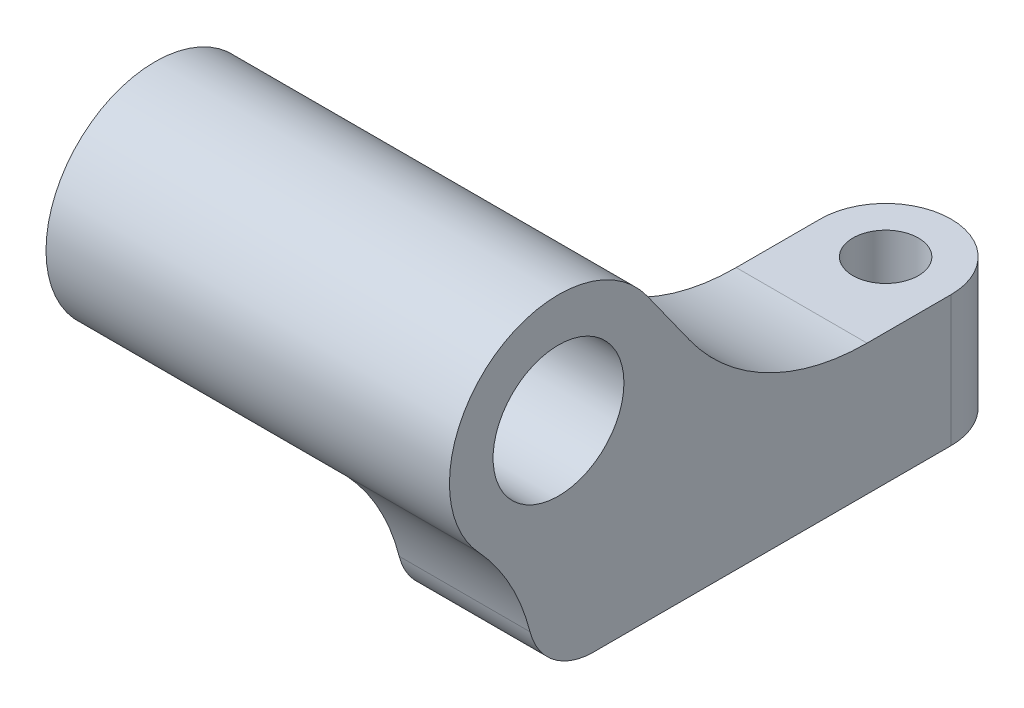
from build123d import *

# Parameters (mm, degrees)
BOSS_EXTRU_1_DEPTH      = 6
CONG_3_R                = 10
BOSS_EXTRU_2_START      = 12.5
ESQUISSE2_R             = 5
BOSS_EXTRU_2_DEPTH      = 12.5
ESQUISSE3_R             = 3
ENL_V_MAT_EXTRU_1_DEPTH = 27.424420523
BOSS_EXTRU_3_DEPTH      = 6
CONG_5_R                = 10
ESQUISSE5_R             = 1.5
ENL_V_MAT_EXTRU_2_DEPTH = 27.043233286
CONG_7_R                = 3


with BuildPart() as part:
    # Esquisse1 → Boss.-Extru.1 (new body)
    with BuildSketch(Plane(origin=(0, 0, 0), x_dir=(0, 0, -1), z_dir=(1, 0, 0))):
        with BuildLine():
            Line((-1, -4.898979486), (-1, -10))
            Line((-1, -10), (16, -10))
            Line((16, -10), (14, -4))
            Line((14, -4), (9, -4))
            Line((9, -4), (4.06913018, 2.905542906))
            ThreePointArc((4.06913018, 2.905542906), (-4.193153044, 2.723502808), (-1, -4.898979486))
        make_face()
    extrude(amount=BOSS_EXTRU_1_DEPTH)

    # Congé3
    # the kernel refuses this fillet: 10 mm, written as the material it adds along each edge
    with BuildSketch(Plane(origin=(0, -4.898979486, 1), x_dir=(0, -1, 0), z_dir=(1, 0, 0))) as cong_3_piece_1:
        with BuildLine():
            CenterArc((5.301220936, -9.997995789), CONG_3_R, 91.147140557, 41.697546603)
            Line((-1.498912679, -2.665998596), (-1.634915351, -2.519358652))
            ThreePointArc((-1.634915351, -2.519358652), (-0.714939835, -1.35240562), (-0.195959179, 0.04))
            Line((-0.195959179, 0.04), (0, 0.2))
            ThreePointArc((0, 0.2), (2.550510257, 0.2), (5.097016506, 0.199959916))
            Line((5.097016506, 0.199959916), (5.101020514, 0))
        make_face()
    extrude(amount=6)

    # Esquisse2 → Boss.-Extru.2 (add)
    with BuildSketch(Plane.ZY.offset(BOSS_EXTRU_2_START)):
        Circle(ESQUISSE2_R)
    extrude(amount=-BOSS_EXTRU_2_DEPTH)

    # Esquisse3 → Enlèv. mat.-Extru.1 (cut, through all)
    with BuildSketch(Plane(origin=(6, 0, 0), x_dir=(0, 0, -1), z_dir=(1, 0, 0))):
        Circle(ESQUISSE3_R)
    extrude(amount=-ENL_V_MAT_EXTRU_1_DEPTH, mode=Mode.SUBTRACT)

    # Esquisse4 → Boss.-Extru.3 (add)
    with BuildSketch(Plane.XZ.offset(10)):
        with BuildLine():
            Line((6, -11), (0, -11))
            Line((0, -11), (0, -18))
            ThreePointArc((0, -18), (3, -21), (6, -18))
            Line((6, -18), (6, -11))
        make_face()
    extrude(amount=-BOSS_EXTRU_3_DEPTH)

    # Congé5
    # the kernel refuses this fillet: 10 mm, written as the material it adds along each edge
    with BuildSketch(Plane(origin=(0, -4, -9), x_dir=(0, 0.813826036051075, 0.5811085811149191), z_dir=(1, 0, 0))) as cong_5_piece_1:
        with BuildLine():
            CenterArc((CONG_5_R * 0.514718625761, -CONG_5_R), CONG_5_R, 90, 54.471447841)
            Line((-CONG_5_R * 0.29910741029, -CONG_5_R * 0.418891418885), (0, 0))
            Line((0, 0), (CONG_5_R * 0.514718625761, 0))
        make_face()
    extrude(amount=6)

    # Esquisse5 → Enlèv. mat.-Extru.2 (cut, through all)
    with BuildSketch(Plane(origin=(0, -4, 0), x_dir=(1, 0, 0), z_dir=(0, 1, 0))):
        with Locations(Location((3, 18, 0), (0, 0, 270))):
            Circle(ESQUISSE5_R)
    extrude(amount=-ENL_V_MAT_EXTRU_2_DEPTH, mode=Mode.SUBTRACT)

    # Congé7
    cong_7_edges = [part.edges().sort_by_distance(p)[0] for p in [
        (3, -10, 1),
    ]]
    fillet(cong_7_edges, radius=CONG_7_R)


solid = part.part
